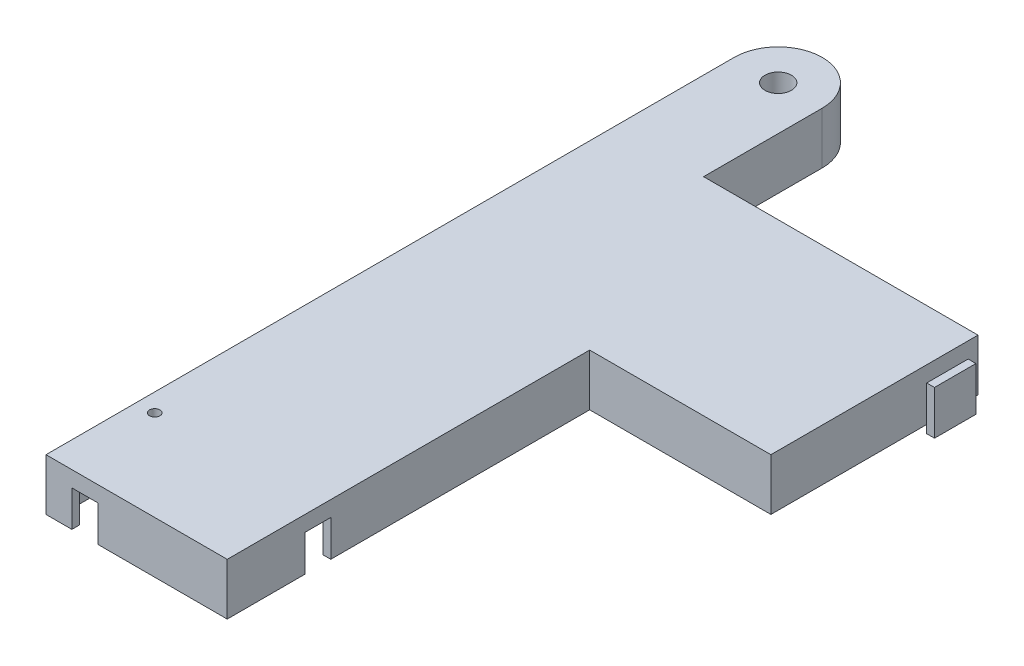
from build123d import *

# Parameters (mm, degrees)
CORNERBOSS_EXTRUDE1_DEPTH               = 20
SHELL2_T                                = -3
PADSKETCH3_R                            = 12
PADSKETCH3_R_2                          = 5
PADBOSS_EXTRUDE2_DEPTH                  = 10
STEPPERSHAFTHOLESKETCH4_R               = 5.1
STEPPERSHAFTHOLESKETCH4_R_2             = 2
STEPPERSHAFTCUT_EXTRUDE2_DEPTH          = 316.846451025
THREADEDNUTMOUNTHOLESSKETCH5_R          = 2
THREADEDNUTMOUNTHOLESCUT_EXTRUDE4_DEPTH = 10
TRPEGSKETCH1_W                          = 9.8
TRPEGSKETCH1_H                          = 13.9
TRPEGBOSS_EXTRUDE1_DEPTH                = 3.1
TRPEGCAPSKETCH2_W                       = 16
TRPEGCAPSKETCH2_H                       = 17
TRPEGCAPBOSS_EXTRUDE2_DEPTH             = 3
BOTTOMPEGHOLESKETCH3_W                  = 10
BOTTOMPEGHOLESKETCH3_H                  = 13.9
BOTTOMPEGHOLECUT_EXTRUDE1_DEPTH         = 3
BEDCENTERPEGHOLECUTSKETCH1_W            = 10
BEDCENTERPEGHOLECUTSKETCH1_H            = 14
BEDCENTERPEGHOLECUT_EXTRUDE1_DEPTH      = 3


with BuildPart() as part:
    # CornerrSketch1 → CornerBoss-Extrude1 (new body)
    with BuildSketch(Plane(origin=(0, 0, 0), x_dir=(1, 0, 0), z_dir=(0, 1, 0))):
        with BuildLine():
            Line((140, 220), (140, 140))
            Line((140, 140), (70, 140))
            Line((70, 140), (70, 0))
            Line((70, 0), (0, 0))
            Line((0, 0), (0, 265.825))
            ThreePointArc((0, 265.825), (17, 282.825), (34, 265.825))
            Line((34, 265.825), (34, 220))
            Line((34, 220), (140, 220))
        make_face()
    extrude(amount=CORNERBOSS_EXTRUDE1_DEPTH)

    # Shell2
    shell2_openings = [part.faces().sort_by_distance(p)[0] for p in [
        (50.460788317, 0, -139.249856422),
    ]]
    offset(amount=SHELL2_T, openings=shell2_openings, kind=Kind.INTERSECTION)

    # PadSketch3 → PadBoss-Extrude2 (add)
    with BuildSketch(Plane.XZ.offset(-17)):
        with Locations((17, -265.825)):
            Circle(PADSKETCH3_R)
        with Locations((7, -35)):
            Circle(PADSKETCH3_R_2)
    extrude(amount=PADBOSS_EXTRUDE2_DEPTH)

    # StepperShaftHoleSketch4 → StepperShaftCut-Extrude2 (cut, through all)
    with BuildSketch(Plane.XZ.offset(-7)):
        with Locations((17, -265.825)):
            Circle(STEPPERSHAFTHOLESKETCH4_R)
        with Locations((7, -35)):
            Circle(STEPPERSHAFTHOLESKETCH4_R_2)
    extrude(amount=-STEPPERSHAFTCUT_EXTRUDE2_DEPTH, mode=Mode.SUBTRACT)

    # ThreadedNutMountHolesSketch5 → ThreadedNutMountHolesCut-Extrude4 (cut)
    with BuildSketch(Plane(origin=(0, 7, 0), x_dir=(-1, 0, 0), z_dir=(0, -1, 0))):
        with Locations((-17, 273.825)):
            Circle(THREADEDNUTMOUNTHOLESSKETCH5_R)
        with Locations((-9, 265.825)):
            Circle(THREADEDNUTMOUNTHOLESSKETCH5_R)
        with Locations((-17, 257.825)):
            Circle(THREADEDNUTMOUNTHOLESSKETCH5_R)
        with Locations((-25, 265.825)):
            Circle(THREADEDNUTMOUNTHOLESSKETCH5_R)
    extrude(amount=-THREADEDNUTMOUNTHOLESCUT_EXTRUDE4_DEPTH, mode=Mode.SUBTRACT)

    # TRPegSketch1 → TRPegBoss-Extrude1 (add)
    with BuildSketch(Plane(origin=(140, 0, 0), x_dir=(0, 0, -1), z_dir=(1, 0, 0))):
        with Locations((205, 6.95)):
            Rectangle(TRPEGSKETCH1_W, TRPEGSKETCH1_H)
    extrude(amount=TRPEGBOSS_EXTRUDE1_DEPTH)

    # TRPegCapSketch2 → TRPegCapBoss-Extrude2 (add)
    with BuildSketch(Plane(origin=(143.1, 0, 0), x_dir=(0, 0, -1), z_dir=(1, 0, 0))):
        with Locations((205.1, 8.5)):
            Rectangle(TRPEGCAPSKETCH2_W, TRPEGCAPSKETCH2_H)
    extrude(amount=TRPEGCAPBOSS_EXTRUDE2_DEPTH)

    # BottomPegHoleSketch3 → BottomPegHoleCut-Extrude1 (cut)
    with BuildSketch(Plane.XY):
        with Locations((15, 6.95)):
            Rectangle(BOTTOMPEGHOLESKETCH3_W, BOTTOMPEGHOLESKETCH3_H)
    extrude(amount=-BOTTOMPEGHOLECUT_EXTRUDE1_DEPTH, mode=Mode.SUBTRACT)

    # BedCenterPegHoleCutSketch1 → BedCenterPegHoleCut-Extrude1 (cut)
    with BuildSketch(Plane(origin=(70, 0, 0), x_dir=(0, 0, -1), z_dir=(1, 0, 0))):
        with Locations((35, 7)):
            Rectangle(BEDCENTERPEGHOLECUTSKETCH1_W, BEDCENTERPEGHOLECUTSKETCH1_H)
    extrude(amount=-BEDCENTERPEGHOLECUT_EXTRUDE1_DEPTH, mode=Mode.SUBTRACT)


solid = part.part
